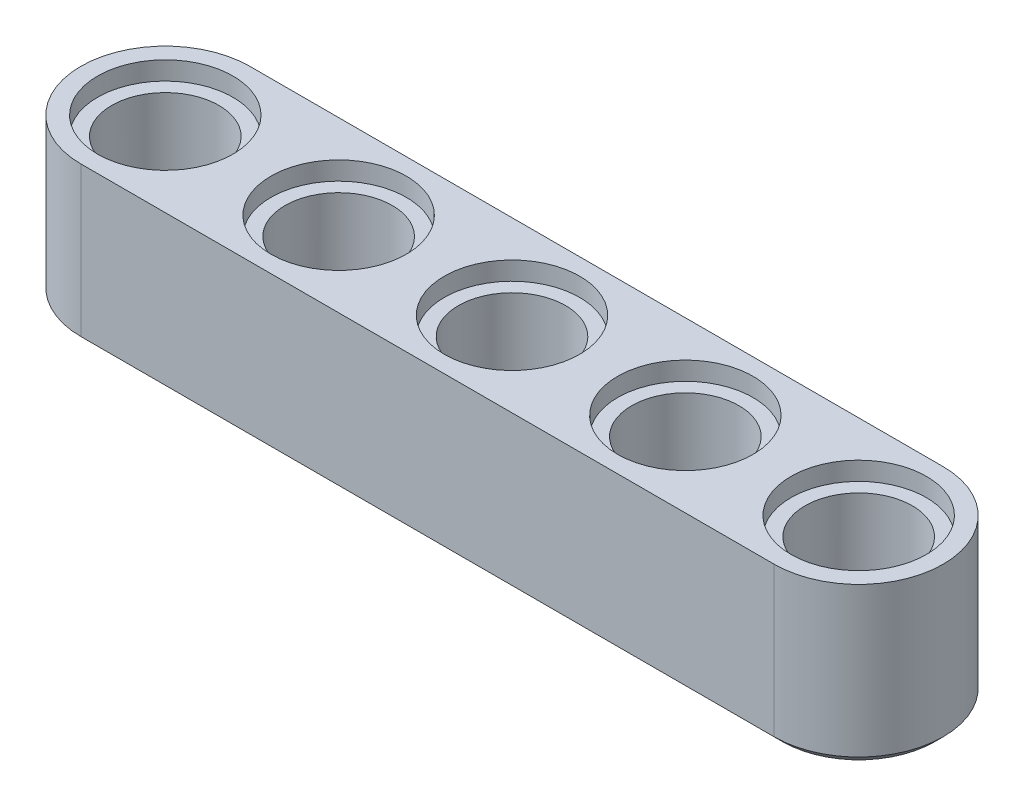
from build123d import *

# Parameters (mm, degrees)
BOSS_EXTRUDE1_DEPTH       = 7.3
SKETCH2_R                 = 2.475
CUT_EXTRUDE1_DEPTH        = 37.841688344
SKETCH3_R                 = 3.125
CUT_EXTRUDE2_DEPTH        = 0.85
LPATTERN1_COUNT           = 5
LPATTERN1_PITCH           = 8
LPATTERN1_COPY_1_SKETCH_R = 3.125
LPATTERN1_COPY_1_DEPTH    = 0.85
LPATTERN1_COPY_2_SKETCH_R = 3.125
LPATTERN1_COPY_2_DEPTH    = 0.85
LPATTERN1_COPY_3_SKETCH_R = 3.125
LPATTERN1_COPY_3_DEPTH    = 0.85
LPATTERN1_COPY_4_SKETCH_R = 3.125
LPATTERN1_COPY_4_DEPTH    = 0.85
CHAMFER1_SIZE             = 0.4


with BuildPart() as part:
    # Sketch1 → Boss-Extrude1 (new body)
    with BuildSketch(Plane(origin=(0, 0, 0), x_dir=(1, 0, 0), z_dir=(0, 1, 0))):
        with BuildLine():
            Line((0, 3.9), (32, 3.9))
            ThreePointArc((32, 3.9), (35.9, 0), (32, -3.9))
            Line((32, -3.9), (0, -3.9))
            ThreePointArc((0, -3.9), (-3.9, 0), (0, 3.9))
        make_face()
    extrude(amount=BOSS_EXTRUDE1_DEPTH)

    # Sketch2 → Cut-Extrude1 (cut, through all)
    with BuildSketch(Plane(origin=(0, 7.3, 0), x_dir=(1, 0, 0), z_dir=(0, 1, 0))):
        with Locations(Location((0, 0, 0), (0, 0, 270))):
            Circle(SKETCH2_R)
    cut_extrude1 = extrude(amount=-CUT_EXTRUDE1_DEPTH, mode=Mode.SUBTRACT)

    # Sketch3 → Cut-Extrude2 (cut)
    with BuildSketch(Plane(origin=(0, 7.3, 0), x_dir=(1, 0, 0), z_dir=(0, 1, 0))):
        with Locations(Location((0, 0, 0), (0, 0, 270))):
            Circle(SKETCH3_R)
    cut_extrude2 = extrude(amount=-CUT_EXTRUDE2_DEPTH, mode=Mode.SUBTRACT)

    # Mirror1: Cut-Extrude2 across plane
    add(cut_extrude2.mirror(Plane.ZX.offset(3.65)), mode=Mode.SUBTRACT)

    # LPattern1: Cut-Extrude1, Cut-Extrude2 ×5
    with Locations(*[(i * LPATTERN1_PITCH, 0, 0) for i in range(1, LPATTERN1_COUNT)]):
        add(cut_extrude1, mode=Mode.SUBTRACT)
        add(cut_extrude2, mode=Mode.SUBTRACT)

    # LPattern1 copy 1 sketch → LPattern1 copy 1 (cut)
    with BuildSketch(Plane(origin=(8, 0, 0), x_dir=(1, 0, 0), z_dir=(0, -1, 0))):
        Circle(LPATTERN1_COPY_1_SKETCH_R)
    extrude(amount=-LPATTERN1_COPY_1_DEPTH, mode=Mode.SUBTRACT)

    # LPattern1 copy 2 sketch → LPattern1 copy 2 (cut)
    with BuildSketch(Plane(origin=(16, 0, 0), x_dir=(1, 0, 0), z_dir=(0, -1, 0))):
        Circle(LPATTERN1_COPY_2_SKETCH_R)
    extrude(amount=-LPATTERN1_COPY_2_DEPTH, mode=Mode.SUBTRACT)

    # LPattern1 copy 3 sketch → LPattern1 copy 3 (cut)
    with BuildSketch(Plane(origin=(24, 0, 0), x_dir=(1, 0, 0), z_dir=(0, -1, 0))):
        Circle(LPATTERN1_COPY_3_SKETCH_R)
    extrude(amount=-LPATTERN1_COPY_3_DEPTH, mode=Mode.SUBTRACT)

    # LPattern1 copy 4 sketch → LPattern1 copy 4 (cut)
    with BuildSketch(Plane(origin=(32, 0, 0), x_dir=(1, 0, 0), z_dir=(0, -1, 0))):
        Circle(LPATTERN1_COPY_4_SKETCH_R)
    extrude(amount=-LPATTERN1_COPY_4_DEPTH, mode=Mode.SUBTRACT)

    # Chamfer1
    # the kernel refuses this chamfer: 0.4 mm, written as the material it takes off along each edge
    with BuildSketch(Plane(origin=(0, 0, 0), x_dir=(0, 0, 1), z_dir=(-1, 0, 0))) as chamfer1_piece_1:
        Polygon((3.125 + CHAMFER1_SIZE, 0), (3.125, CHAMFER1_SIZE), (3.125, 0), align=None)
    revolve(axis=Axis((0, 0, 0), (0, 1, 0)), mode=Mode.SUBTRACT)
    with BuildSketch(Plane(origin=(0, 0, -3.9), x_dir=(0, 0.9996219169112968, -0.027495876610586275), z_dir=(1, 0, 0))) as chamfer1_piece_2:
        Polygon((CHAMFER1_SIZE * 0.999621916911, CHAMFER1_SIZE * 0.0274958766106), (-CHAMFER1_SIZE * 0.0274958766106, CHAMFER1_SIZE * 0.999621916911), (0, 0), align=None)
    extrude(amount=32, mode=Mode.SUBTRACT)
    with BuildSketch(Plane(origin=(32, 0, 0), x_dir=(0, 0, -1), z_dir=(-1, 0, 0))) as chamfer1_piece_3:
        Polygon((3.9, -CHAMFER1_SIZE), (3.9 - CHAMFER1_SIZE, 0), (3.9, 0), align=None)
    revolve(axis=Axis((32, 0, 0), (0, -1, 0)), revolution_arc=180, mode=Mode.SUBTRACT)
    with BuildSketch(Plane(origin=(32, 0, 3.9), x_dir=(0, -0.027495876610586386, -0.9996219169112968), z_dir=(-1, 0, 0))) as chamfer1_piece_4:
        Polygon((CHAMFER1_SIZE * 0.999621916911, -CHAMFER1_SIZE * 0.0274958766106), (-CHAMFER1_SIZE * 0.0274958766106, -CHAMFER1_SIZE * 0.999621916911), (0, 0), align=None)
    extrude(amount=32, mode=Mode.SUBTRACT)
    with BuildSketch(Plane(origin=(0, 0, 0), x_dir=(0, 0, 1), z_dir=(1, 0, 0))) as chamfer1_piece_5:
        Polygon((3.9, -CHAMFER1_SIZE), (3.9 - CHAMFER1_SIZE, 0), (3.9, 0), align=None)
    revolve(axis=Axis((0, 0, 0), (0, -1, 0)), revolution_arc=180, mode=Mode.SUBTRACT)
    with BuildSketch(Plane(origin=(8, 0, 0), x_dir=(1, 0, 0), z_dir=(0, 0, -1))) as chamfer1_piece_6:
        Polygon((3.125 + CHAMFER1_SIZE, 0), (3.125, -CHAMFER1_SIZE), (3.125, 0), align=None)
    revolve(axis=Axis((8, 0, 0), (0, -1, 0)), mode=Mode.SUBTRACT)
    with BuildSketch(Plane(origin=(16, 0, 0), x_dir=(1, 0, 0), z_dir=(0, 0, -1))) as chamfer1_piece_7:
        Polygon((3.125 + CHAMFER1_SIZE, 0), (3.125, -CHAMFER1_SIZE), (3.125, 0), align=None)
    revolve(axis=Axis((16, 0, 0), (0, -1, 0)), mode=Mode.SUBTRACT)
    with BuildSketch(Plane(origin=(24, 0, 0), x_dir=(1, 0, 0), z_dir=(0, 0, -1))) as chamfer1_piece_8:
        Polygon((3.125 + CHAMFER1_SIZE, 0), (3.125, -CHAMFER1_SIZE), (3.125, 0), align=None)
    revolve(axis=Axis((24, 0, 0), (0, -1, 0)), mode=Mode.SUBTRACT)
    with BuildSketch(Plane(origin=(32, 0, 0), x_dir=(1, 0, 0), z_dir=(0, 0, -1))) as chamfer1_piece_9:
        Polygon((3.125 + CHAMFER1_SIZE, 0), (3.125, -CHAMFER1_SIZE), (3.125, 0), align=None)
    revolve(axis=Axis((32, 0, 0), (0, -1, 0)), mode=Mode.SUBTRACT)


solid = part.part
